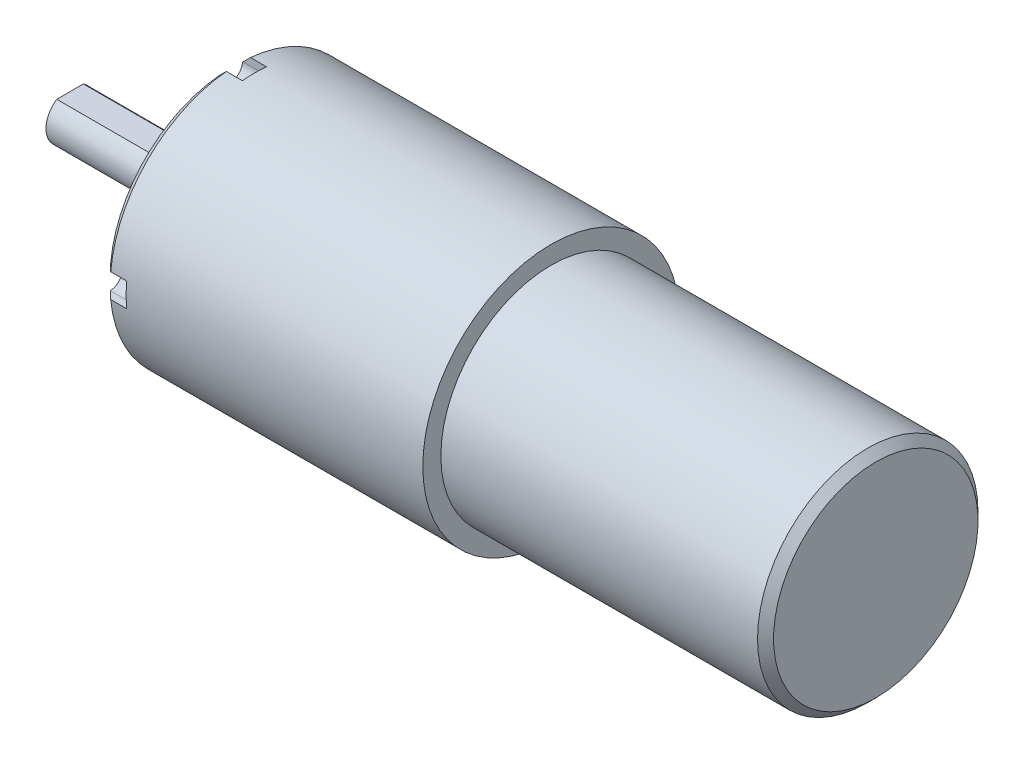
from build123d import *

# Parameters (mm, degrees)
ENL_V_START             = -12
ENL_V_MAT_EXTRU_1_DEPTH = 12
ENL_V_START_2           = -3
ENL_V_MAT_EXTRU_2_DEPTH = 3
CHANFREIN1_SIZE         = 1
ENL_V_MAT_EXTRU_3_DEPTH = 3
ESQUISSE5_R             = 0.75
BOSS_EXTRU_1_DEPTH      = 0.5
CONG_1_R                = 0.5
ESQUISSE6_R             = 1.5
ENL_V_MAT_EXTRU_4_DEPTH = 5.5
CHANFREIN2_SIZE         = 1


with BuildPart() as part:
    # Esquisse1 → Révolution1 (revolve)
    with BuildSketch(Plane.XY):
        Polygon((0, 0), (0, 3), (17, 3), (17, 10), (20, 10), (20, 16), (60, 16), (60, 13.75), (100.5, 13.75), (100.5, 0), align=None)
    revolve(axis=Axis((100.5, 0, 0), (-1, 0, 0)))

    # Esquisse2 → Enlèv. mat.-Extru.1 (cut)
    with BuildSketch(Plane.ZY.offset(ENL_V_START)):
        with BuildLine():
            Line((-1.658312395, 2.5), (1.658312395, 2.5))
            ThreePointArc((1.658312395, 2.5), (0, 3), (-1.658312395, 2.5))
        make_face()
    extrude(amount=ENL_V_MAT_EXTRU_1_DEPTH, mode=Mode.SUBTRACT)

    # Esquisse3 → Enlèv. mat.-Extru.2 (cut)
    with BuildSketch(Plane.ZY.offset(-17).offset(ENL_V_START_2)):
        with BuildLine():
            ThreePointArc((-9, 4.358898944), (-10, 0), (-9, -4.358898944))
            Line((-9, -4.358898944), (-9, 4.358898944))
        make_face()
        with BuildLine():
            Line((9, 4.358898944), (9, -4.358898944))
            ThreePointArc((9, -4.358898944), (9.746794345, -2.236067977), (10, 0))
            ThreePointArc((10, 0), (9.746794345, 2.236067977), (9, 4.358898944))
        make_face()
    extrude(amount=ENL_V_MAT_EXTRU_2_DEPTH, mode=Mode.SUBTRACT)

    # Chanfrein1
    chanfrein1_edges = [part.edges().sort_by_distance(p)[0] for p in [
        (20, -16, 0),
    ]]
    chamfer(chanfrein1_edges, length=CHANFREIN1_SIZE)

    # Esquisse4 → Enlèv. mat.-Extru.3 (cut)
    with BuildSketch(Plane.ZY.offset(-20)):
        with BuildLine():
            Line((16, 1.5), (15, 1.5))
            ThreePointArc((15, 1.5), (13.5, 0), (15, -1.5))
            Line((15, -1.5), (16, -1.5))
            Line((16, -1.5), (16, 1.5))
        make_face()
        with BuildLine():
            Line((1.5, -16), (1.5, -15))
            ThreePointArc((1.5, -15), (0, -13.5), (-1.5, -15))
            Line((-1.5, -15), (-1.5, -16))
            Line((-1.5, -16), (1.5, -16))
        make_face()
        with BuildLine():
            Line((-16, -1.5), (-15, -1.5))
            ThreePointArc((-15, -1.5), (-13.5, 0), (-15, 1.5))
            Line((-15, 1.5), (-16, 1.5))
            Line((-16, 1.5), (-16, -1.5))
        make_face()
        with BuildLine():
            Line((-1.5, 16), (-1.5, 15))
            ThreePointArc((-1.5, 15), (0, 13.5), (1.5, 15))
            Line((1.5, 15), (1.5, 16))
            Line((1.5, 16), (-1.5, 16))
        make_face()
    extrude(amount=-ENL_V_MAT_EXTRU_3_DEPTH, mode=Mode.SUBTRACT)

    # Esquisse5 → Boss.-Extru.1 (add)
    with BuildSketch(Plane.ZY.offset(-23)):
        with Locations(Location((0, 15, 0), (0, 0, 270))):
            Circle(ESQUISSE5_R)
        with Locations(Location((15, 0, 0), (0, 0, 270))):
            Circle(ESQUISSE5_R)
        with Locations(Location((0, -15, 0), (0, 0, 270))):
            Circle(ESQUISSE5_R)
        with Locations(Location((-15, 0, 0), (0, 0, 270))):
            Circle(ESQUISSE5_R)
    extrude(amount=BOSS_EXTRU_1_DEPTH)

    # Congé1
    cong_1_edges = [part.edges().sort_by_distance(p)[0] for p in [
        (22.5, 15.75, 0),
        (22.5, 0.75, 15),
        (22.5, -14.25, 0),
        (22.5, 0.75, -15),
    ]]
    fillet(cong_1_edges, radius=CONG_1_R - 0.0001)  # a hair under: the kernel refuses the full size

    # Esquisse6 → Enlèv. mat.-Extru.4 (cut)
    with BuildSketch(Plane.ZY.offset(-20)):
        with Locations(Location((9.192388155, 9.192388155, 0), (0, 0, 270))):
            Circle(ESQUISSE6_R)
        with Locations(Location((9.192388155, -9.192388155, 0), (0, 0, 270))):
            Circle(ESQUISSE6_R)
        with Locations(Location((-9.192388155, -9.192388155, 0), (0, 0, 270))):
            Circle(ESQUISSE6_R)
        with Locations(Location((-9.192388155, 9.192388155, 0), (0, 0, 270))):
            Circle(ESQUISSE6_R)
    extrude(amount=-ENL_V_MAT_EXTRU_4_DEPTH, mode=Mode.SUBTRACT)

    # Chanfrein2
    chanfrein2_edges = [part.edges().sort_by_distance(p)[0] for p in [
        (100.5, -13.75, 0),
    ]]
    chamfer(chanfrein2_edges, length=CHANFREIN2_SIZE)


solid = part.part
